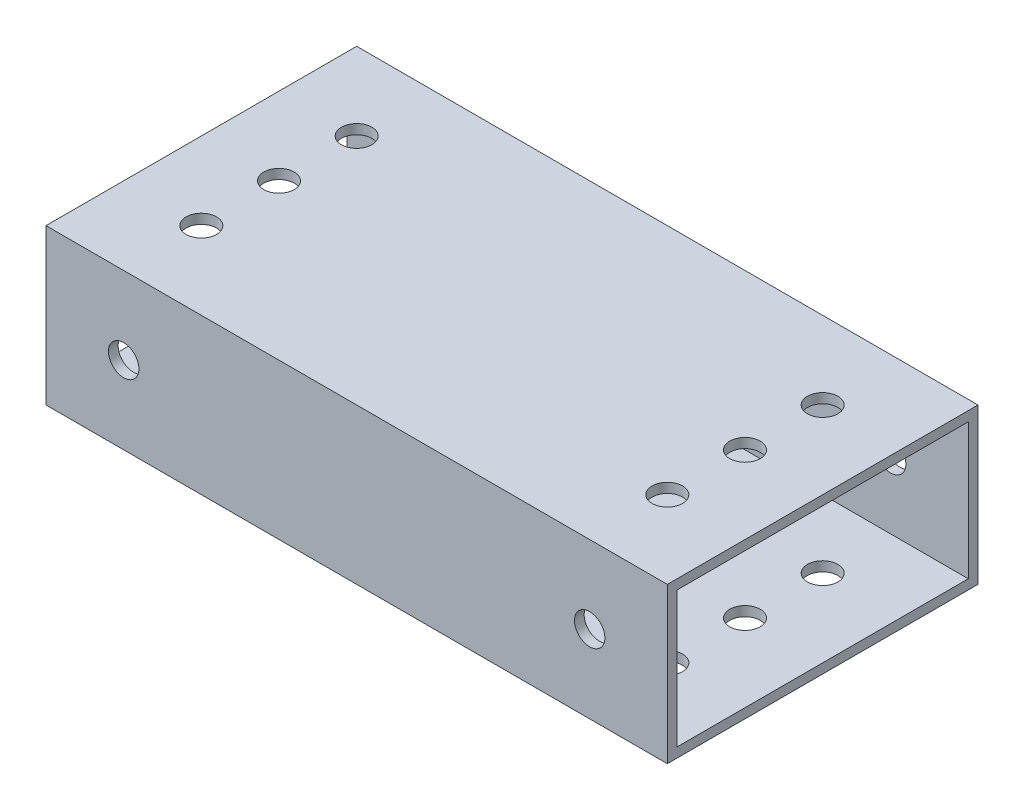
from build123d import *

# Parameters (mm, degrees)
SKETCH1_W           = 50.8
SKETCH1_H           = 25.4
BOSS_EXTRUDE1_DEPTH = 50.8
SHELL1_T            = -1.5875
SKETCH2_R           = 2.4892
CUT_EXTRUDE1_DEPTH  = 77.2
SKETCH3_R           = 2.4892
CUT_EXTRUDE2_DEPTH  = 77.2


with BuildPart() as part:
    # Sketch1 → Boss-Extrude1 (new, symmetric)
    with BuildSketch(Plane(origin=(0, 0, 0), x_dir=(0, 0, -1), z_dir=(1, 0, 0))):
        with Locations((25.4, 12.7)):
            Rectangle(SKETCH1_W, SKETCH1_H)
    extrude(amount=BOSS_EXTRUDE1_DEPTH, both=True)

    # Shell1
    shell1_openings = [part.faces().sort_by_distance(p)[0] for p in [
        (-50.8, 12.7, -25.4),
        (50.8, 12.7, -25.4),
    ]]
    offset(amount=SHELL1_T, openings=shell1_openings, kind=Kind.INTERSECTION)

    # Sketch2 → Cut-Extrude1 (cut, through all)
    with BuildSketch(Plane(origin=(0, 25.4, 0), x_dir=(1, 0, 0), z_dir=(0, 1, 0))):
        with Locations((-38.1, 25.4)):
            Circle(SKETCH2_R)
        with Locations((-38.1, 12.7)):
            Circle(SKETCH2_R)
        with Locations((-38.1, 38.1)):
            Circle(SKETCH2_R)
    cut_extrude1 = extrude(amount=-CUT_EXTRUDE1_DEPTH, mode=Mode.SUBTRACT)

    # Sketch3 → Cut-Extrude2 (cut, through all)
    with BuildSketch(Plane.XY):
        with Locations((-38.1, 12.7)):
            Circle(SKETCH3_R)
    cut_extrude2 = extrude(amount=-CUT_EXTRUDE2_DEPTH, mode=Mode.SUBTRACT)

    # Mirror1: Cut-Extrude1, Cut-Extrude2 across plane
    add(cut_extrude1.mirror(Plane(origin=(0, 0, 0), x_dir=(0, 0, 1), z_dir=(1, 0, 0))), mode=Mode.SUBTRACT)
    add(cut_extrude2.mirror(Plane(origin=(0, 0, 0), x_dir=(0, 0, 1), z_dir=(1, 0, 0))), mode=Mode.SUBTRACT)


solid = part.part
